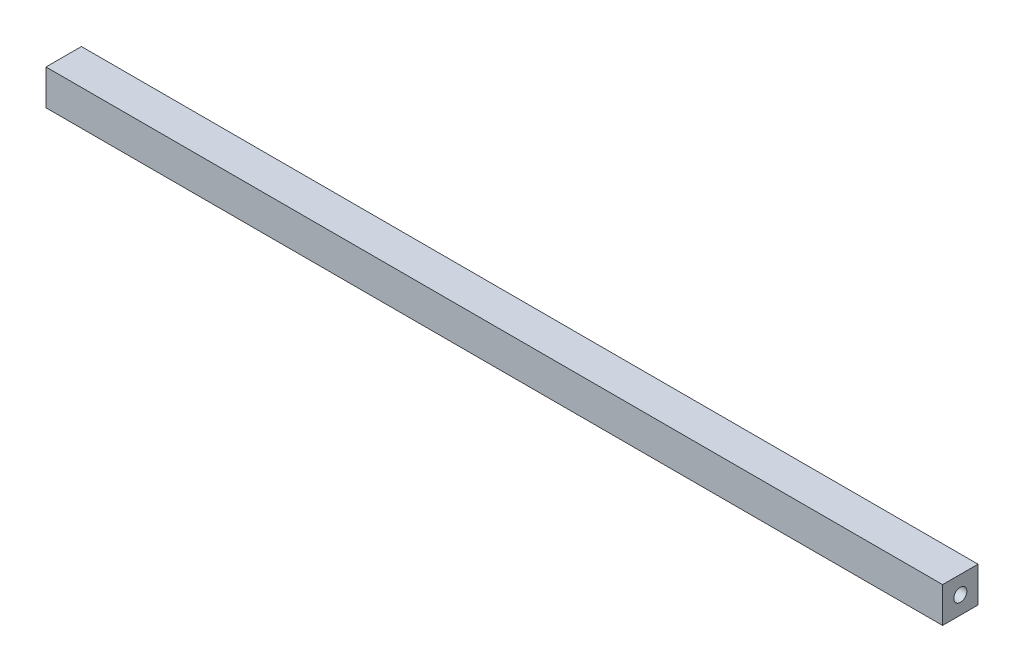
from build123d import *

# Parameters (mm, degrees)
BOSS_EXTRUDE1_DEPTH      = 457.2
BOSS_EXTRUDE1_DEPTH_BACK = 38.1
SKETCH1_W                = 19.558
SKETCH1_H                = 19.558
SKETCH2_R                = 3.6195
CUT_EXTRUDE1_DEPTH       = 38.1


with BuildPart() as part:
    # Sketch1 → Boss-Extrude1 (new, two sides: drawn at the far end of the back side and taken through both)
    with BuildSketch(Plane.ZY.offset(17.272).offset(-BOSS_EXTRUDE1_DEPTH_BACK)):
        with Locations((44.45, 101.6)):
            Rectangle(SKETCH1_W, SKETCH1_H)
    extrude(amount=BOSS_EXTRUDE1_DEPTH + BOSS_EXTRUDE1_DEPTH_BACK)

    # Sketch2 → Cut-Extrude1 (cut)
    with BuildSketch(Plane(origin=(20.828, 0, 0), x_dir=(0, 0, -1), z_dir=(1, 0, 0))):
        with Locations((-44.45, 101.6)):
            Circle(SKETCH2_R)
    extrude(amount=-CUT_EXTRUDE1_DEPTH, mode=Mode.SUBTRACT)


solid = part.part
